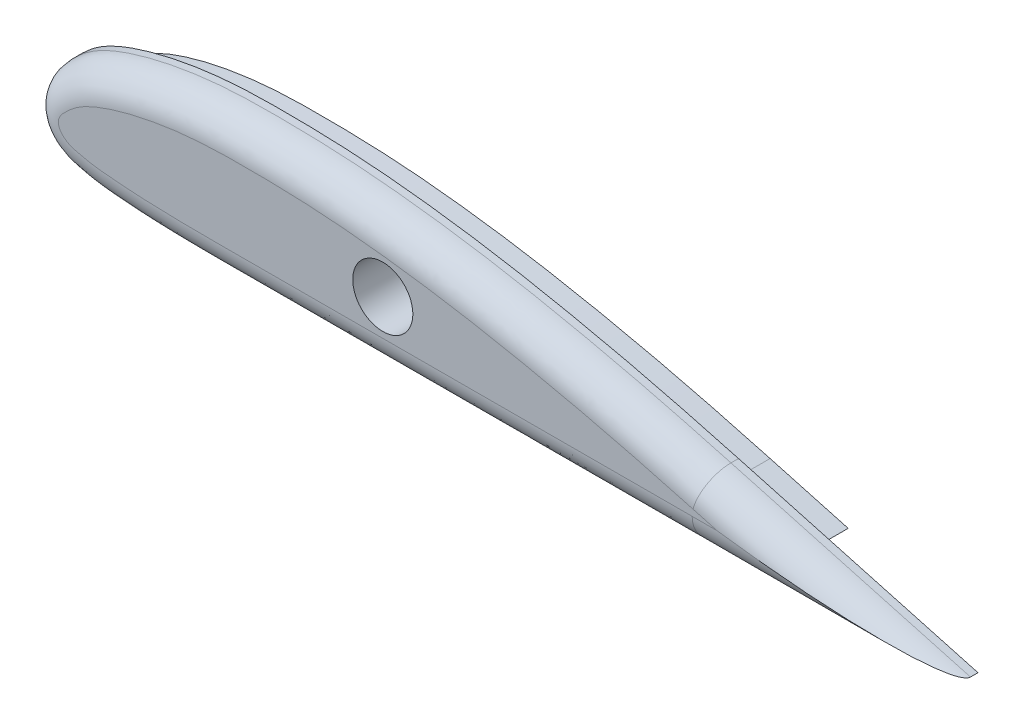
from build123d import *

# Parameters (mm, degrees)
BOSS_EXTRUDE1_DEPTH = 10
FILLET1_R           = 4
CUT_EXTRUDE1_DEPTH  = 5
SKETCH3_R           = 4
CUT_EXTRUDE2_DEPTH  = 477.108367766


with BuildPart() as part:
    # Sketch1 → Boss-Extrude1 (new body)
    with BuildSketch(Plane.XY):
        with BuildLine():
            Line((441.393772372, 20.11245238), (474.43313548, 20.11245238))
            Line((474.43313548, 20.11245238), (442.557049848, 28.856277993))
            add(Edge.make_bspline(
                [(442.557049848, 28.856277993), (439.072672673, 29.812066189), (432.09991262, 31.671596216), (421.486806006, 34.110578028), (410.779849111, 36.19753981), (401.720197274, 37.488657384), (394.412818539, 38.20453267), (388.865337546, 38.535909849), (383.377043684, 38.645396216), (378.7767391, 38.631004567), (374.963490259, 38.431919098), (372.066182641, 38.140016342), (369.210683302, 37.706967221), (366.827818433, 37.231436262), (364.908429326, 36.753895892), (363.479940401, 36.349485655), (362.056434922, 35.895767331), (360.572839349, 35.352857227), (359.287698264, 34.784145271), (358.216447641, 34.21460014), (357.389050585, 33.706898074), (356.552615658, 33.103064875), (355.820762746, 32.475335753), (355.354503463, 32.044209503), (354.855699671, 31.552849553), (354.389957132, 31.025585157), (353.964999314, 30.449203447), (353.586282933, 29.767186255), (353.227738955, 28.932944297), (352.961298812, 27.649941627), (353.111643283, 26.298326889), (353.365330175, 25.450623284), (353.695602528, 24.752886461), (353.998210399, 24.262418144), (354.347839516, 23.793022868), (354.788881726, 23.301715107), (355.325142217, 22.811112843), (356.055967315, 22.286834279), (356.839748986, 21.871835881), (357.765467063, 21.506816056), (358.640116289, 21.281010932), (359.288045988, 21.130261844), (360.069783324, 20.956248021), (360.904853145, 20.805577699), (361.971898146, 20.65201194), (363.214024728, 20.526416591), (364.578709921, 20.410081097), (365.978183778, 20.304620288), (367.378711377, 20.219984968), (369.228950932, 20.131407076), (371.530679735, 20.056360098), (374.271249485, 20.010918971), (376.991001378, 19.994447782), (379.696108674, 19.996368347), (383.274859524, 20.009444007), (387.735021397, 20.017659911), (393.10446141, 20.024425958), (398.470497743, 20.035035638), (403.835453794, 20.044763259), (410.989397892, 20.05802128), (419.931476298, 20.073638873), (430.662185952, 20.093254902), (437.816630749, 20.105643074), (441.393772372, 20.11245238)],
                knots=[0, 0, 0, 0, 0.062498476, 0.124996951, 0.187495427, 0.249993902, 0.28124314, 0.312492378, 0.343741616, 0.374990854, 0.390615473, 0.406240092, 0.42186471, 0.437489329, 0.445301639, 0.453113948, 0.460926258, 0.468738567, 0.476550877, 0.480457031, 0.484363186, 0.488269341, 0.492175496, 0.49608165, 0.498034728, 0.499987805, 0.501940882, 0.502917421, 0.50389396, 0.505847037, 0.506823576, 0.507800114, 0.508776653, 0.509753192, 0.51072973, 0.511706269, 0.513659347, 0.515612424, 0.517565501, 0.519518579, 0.523424733, 0.527330888, 0.531237043, 0.535143198, 0.539049352, 0.546861662, 0.554673971, 0.562486281, 0.57029859, 0.5781109, 0.593735518, 0.609360137, 0.624984756, 0.640609375, 0.656233994, 0.687483232, 0.71873247, 0.749981707, 0.781230945, 0.812480183, 0.874978659, 0.937477134, 0.99997561, 0.99997561, 0.99997561, 0.99997561], degree=3))
        make_face()
    extrude(amount=BOSS_EXTRUDE1_DEPTH)

    # Fillet1
    fillet1_edges = [part.edges().sort_by_distance(p)[0] for p in [
        (458.495092664, 24.484365186, 10),
        (457.913453926, 20.11245238, 10),
        (458.495092664, 24.484365186, 10),
    ]]
    fillet(fillet1_edges, radius=FILLET1_R)

    # Sketch2 → Cut-Extrude1 (cut)
    with BuildSketch(Plane(origin=(0, 0, 0), x_dir=(-1, 0, 0), z_dir=(0, 0, -1))):
        with BuildLine():
            Line((-442.557049848, 28.856277993), (-474.43313548, 20.11245238))
            Line((-474.43313548, 20.11245238), (-441.393772372, 20.11245238))
            add(Edge.make_bspline(
                [(-441.393772372, 20.11245238), (-437.816630749, 20.105643074), (-430.662185952, 20.093254902), (-419.931476298, 20.073638873), (-410.989397892, 20.05802128), (-403.835453794, 20.044763259), (-398.470497743, 20.035035638), (-393.10446141, 20.024425958), (-387.735021397, 20.017659911), (-383.274859524, 20.009444007), (-379.696108674, 19.996368347), (-376.991001378, 19.994447782), (-374.271249485, 20.010918971), (-371.530679735, 20.056360098), (-369.228950932, 20.131407076), (-367.378711377, 20.219984968), (-365.978183778, 20.304620288), (-364.578709921, 20.410081097), (-363.214024728, 20.526416591), (-361.971898146, 20.65201194), (-360.904853145, 20.805577699), (-360.069783324, 20.956248021), (-359.288045988, 21.130261844), (-358.640116289, 21.281010932), (-357.765467063, 21.506816056), (-356.839748986, 21.871835881), (-356.055967315, 22.286834279), (-355.325142217, 22.811112843), (-354.788881726, 23.301715107), (-354.347839516, 23.793022868), (-353.998210399, 24.262418144), (-353.695602528, 24.752886461), (-353.365330175, 25.450623284), (-353.111643283, 26.298326889), (-352.961298812, 27.649941627), (-353.227738955, 28.932944297), (-353.586282933, 29.767186255), (-353.964999314, 30.449203447), (-354.389957132, 31.025585157), (-354.855699671, 31.552849553), (-355.354503463, 32.044209503), (-355.820762746, 32.475335753), (-356.552615658, 33.103064875), (-357.389050585, 33.706898074), (-358.216447641, 34.21460014), (-359.287698264, 34.784145271), (-360.572839349, 35.352857227), (-362.056434922, 35.895767331), (-363.479940401, 36.349485655), (-364.908429326, 36.753895892), (-366.827818433, 37.231436262), (-369.210683302, 37.706967221), (-372.066182641, 38.140016342), (-374.963490259, 38.431919098), (-378.7767391, 38.631004567), (-383.377043684, 38.645396216), (-388.865337546, 38.535909849), (-394.412818539, 38.20453267), (-401.720197274, 37.488657384), (-410.779849111, 36.19753981), (-421.486806006, 34.110578028), (-432.09991262, 31.671596216), (-439.072672673, 29.812066189), (-442.557049848, 28.856277993)],
                knots=[0, 0, 0, 0, 0.062498476, 0.124996951, 0.187495427, 0.218744665, 0.249993902, 0.28124314, 0.312492378, 0.343741616, 0.359366235, 0.374990854, 0.390615473, 0.406240092, 0.42186471, 0.42967702, 0.437489329, 0.445301639, 0.453113948, 0.460926258, 0.464832412, 0.468738567, 0.472644722, 0.476550877, 0.480457031, 0.482410109, 0.484363186, 0.486316263, 0.488269341, 0.48924588, 0.490222418, 0.491198957, 0.492175496, 0.493152034, 0.494128573, 0.49608165, 0.497058189, 0.498034728, 0.499987805, 0.501940882, 0.50389396, 0.507800114, 0.511706269, 0.515612424, 0.519518579, 0.523424733, 0.531237043, 0.539049352, 0.546861662, 0.554673971, 0.562486281, 0.5781109, 0.593735518, 0.609360137, 0.624984756, 0.656233994, 0.687483232, 0.71873247, 0.749981707, 0.812480183, 0.874978659, 0.937477134, 0.99997561, 0.99997561, 0.99997561, 0.99997561], degree=3))
        make_face()
        with BuildLine():
            Line((-441.763445198, 25.963149641), (-452.155815088, 23.11245238))
            Line((-452.155815088, 23.11245238), (-441.390917034, 23.11245238))
            add(Edge.make_bspline(
                [(-441.390917034, 23.11245238), (-426.562730802, 23.084226032), (-411.734546724, 23.060169519), (-393.199313915, 23.024847888), (-389.49226892, 23.020817988), (-383.931699141, 23.010343927), (-382.07817439, 23.003966397), (-378.371126338, 22.994017121), (-376.51760448, 22.993240124), (-372.810580636, 23.030156852), (-370.957078695, 23.067937652), (-368.176855736, 23.182595637), (-367.25088238, 23.230178674), (-365.401864691, 23.352790661), (-364.478546565, 23.425932746), (-363.095412698, 23.553969032), (-362.634705221, 23.599999118), (-361.715757156, 23.716580881), (-361.257538937, 23.787354917), (-360.572829895, 23.919542503), (-360.345094214, 23.968581804), (-359.890026999, 24.070677749), (-359.662628008, 24.12295548), (-359.209955736, 24.233305516), (-358.983981836, 24.289579828), (-358.540666889, 24.428326938), (-358.322542976, 24.508423941), (-357.89792812, 24.703921021), (-357.689527657, 24.819590385), (-357.303069694, 25.085193892), (-357.121331177, 25.232792993), (-356.868675168, 25.479885405), (-356.786958595, 25.566020566), (-356.635588018, 25.744945077), (-356.565652141, 25.838195245), (-356.367740362, 26.125783149), (-356.258267453, 26.334880197), (-356.095150297, 26.778615981), (-356.048624023, 27.008805919), (-356.023786729, 27.482492483), (-356.054775166, 27.714425026), (-356.138393176, 28.058122636), (-356.172931656, 28.170976491), (-356.260209371, 28.387541527), (-356.312340547, 28.492065444), (-356.425630778, 28.697117642), (-356.487376582, 28.797889266), (-356.619395581, 28.990353549), (-356.690396393, 29.082044457), (-356.910244682, 29.350888634), (-357.06770137, 29.520209006), (-357.398075052, 29.844783537), (-357.566718042, 30.003926303), (-357.912114606, 30.314832602), (-358.087112093, 30.467234138), (-358.444532187, 30.759941674), (-358.627803413, 30.899179001), (-359.190022076, 31.297536488), (-359.581707813, 31.536782104), (-360.391462879, 31.974109144), (-360.810042864, 32.174306571), (-362.083141076, 32.726680794), (-362.947997818, 33.030969573), (-364.692154838, 33.582254636), (-365.571886611, 33.827539324), (-367.344899893, 34.264361595), (-368.238517575, 34.454565696), (-370.037096793, 34.78997676), (-370.941660233, 34.936762832), (-372.761877211, 35.186344401), (-373.675856353, 35.288259974), (-375.497367298, 35.447255891), (-376.40689062, 35.503590105), (-379.132820961, 35.622969191), (-380.946710752, 35.638691575), (-384.571734615, 35.618330329), (-386.383152885, 35.587589458), (-390.0023509, 35.457705446), (-391.810044208, 35.356937329), (-395.421773091, 35.086637703), (-397.225767387, 34.916330155), (-402.633342676, 34.32254711), (-406.232678018, 33.819255658), (-413.421260709, 32.623023997), (-416.997592544, 31.931158193), (-424.119266066, 30.426194438), (-427.666451448, 29.61393531), (-434.732320493, 27.864612486), (-438.250807977, 26.926689759), (-441.763445198, 25.963149641)],
                knots=[0, 0, 0, 0, 0.25, 0.25, 0.3125, 0.3125, 0.34375, 0.34375, 0.375, 0.375, 0.40625, 0.40625, 0.421875, 0.421875, 0.4375, 0.4375, 0.4453125, 0.4453125, 0.453125, 0.453125, 0.45703125, 0.45703125, 0.4609375, 0.4609375, 0.46484375, 0.46484375, 0.46875, 0.46875, 0.47265625, 0.47265625, 0.4765625, 0.4765625, 0.478515625, 0.478515625, 0.48046875, 0.48046875, 0.484375, 0.484375, 0.48828125, 0.48828125, 0.4921875, 0.4921875, 0.494140625, 0.494140625, 0.49609375, 0.49609375, 0.498046875, 0.498046875, 0.5, 0.5, 0.50390625, 0.50390625, 0.5078125, 0.5078125, 0.51171875, 0.51171875, 0.515625, 0.515625, 0.5234375, 0.5234375, 0.53125, 0.53125, 0.546875, 0.546875, 0.5625, 0.5625, 0.578125, 0.578125, 0.59375, 0.59375, 0.609375, 0.609375, 0.625, 0.625, 0.65625, 0.65625, 0.6875, 0.6875, 0.71875, 0.71875, 0.75, 0.75, 0.8125, 0.8125, 0.875, 0.875, 0.9375, 0.9375, 1, 1, 1, 1], degree=3))
        make_face(mode=Mode.SUBTRACT)
    extrude(amount=-CUT_EXTRUDE1_DEPTH, mode=Mode.SUBTRACT)

    # Sketch3 → Cut-Extrude2 (cut, through all)
    with BuildSketch(Plane.XY.offset(10)):
        with Locations((400.216480117, 28.828484142)):
            Circle(SKETCH3_R)
    extrude(amount=-CUT_EXTRUDE2_DEPTH, mode=Mode.SUBTRACT)


solid = part.part
